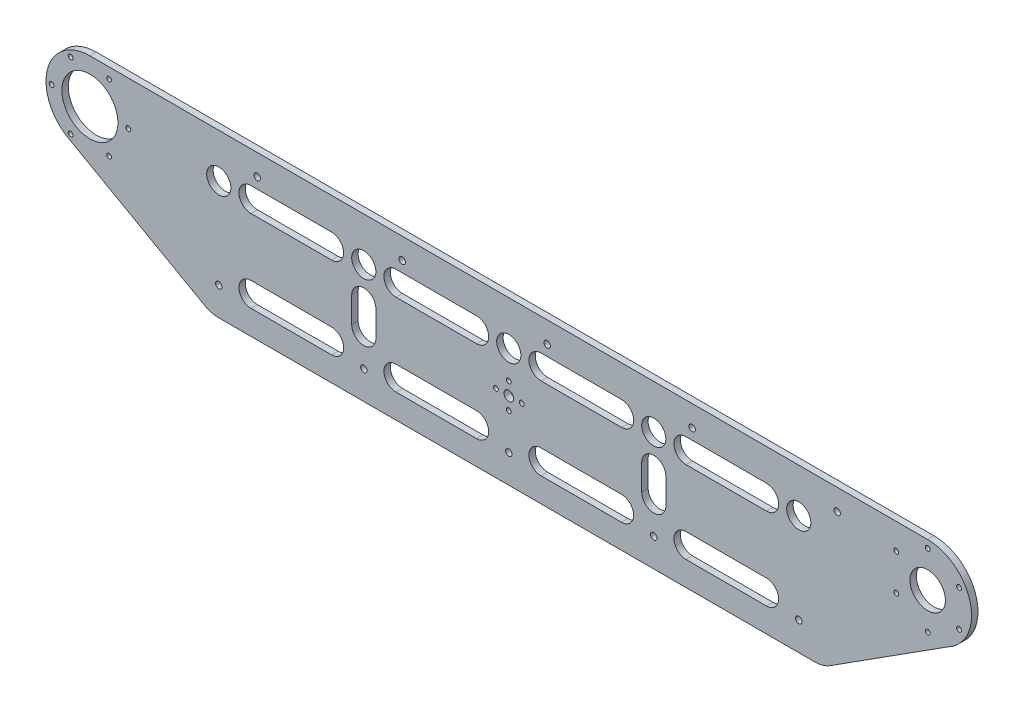
from build123d import *

# Parameters (mm, degrees)
CROQUIS1_R              = 2
CROQUIS1_R_2            = 7.5
CROQUIS1_R_3            = 17.4
CROQUIS1_R_4            = 11
CROQUIS1_R_5            = 1.5
CROQUIS1_R_6            = 3
SALIENTE_EXTRUIR1_DEPTH = 2
CROQUIS2_R              = 1.5
CORTAR_EXTRUIR1_DEPTH   = 10
CROQUIS3_R              = 1.5
CORTAR_EXTRUIR2_DEPTH   = 10
CROQUIS4_R              = 2
CORTAR_EXTRUIR3_DEPTH   = 10


with BuildPart() as part:
    # Croquis1 → Saliente-Extruir1 (new, symmetric)
    with BuildSketch(Plane.XY):
        with BuildLine():
            Line((-179.195612521, -41.480204958), (179.195612521, -41.480204958))
            Line((179.195612521, -41.480204958), (190.010789857, -41.480204958))
            ThreePointArc((190.010789857, -41.480204958), (194.944809403, -40.774865591), (199.483580997, -38.715349889))
            Line((199.483580997, -38.715349889), (272.742664287, 8.031785175))
            ThreePointArc((272.742664287, 8.031785175), (286.437106864, 38.672371901), (260, 59.347542834))
            Line((260, 59.347542834), (-260, 59.347542834))
            ThreePointArc((-260, 59.347542834), (-286.437106864, 38.672371901), (-272.742664287, 8.031785175))
            Line((-272.742664287, 8.031785175), (-188.625622076, -39.240895373))
            ThreePointArc((-188.625622076, -39.240895373), (-184.06774563, -41.022236998), (-179.195612521, -41.480204958))
        make_face()
        with Locations((0, -23.892457166)):
            Circle(CROQUIS1_R, mode=Mode.SUBTRACT)
        with Locations((-90, -23.892457166)):
            Circle(CROQUIS1_R, mode=Mode.SUBTRACT)
        with Locations((-180, -23.892457166)):
            Circle(CROQUIS1_R, mode=Mode.SUBTRACT)
        with Locations((-90, 32.107542834)):
            Circle(CROQUIS1_R_2, mode=Mode.SUBTRACT)
        with Locations((0, 32.107542834)):
            Circle(CROQUIS1_R_2, mode=Mode.SUBTRACT)
        with Locations((-260, 32.107542834)):
            Circle(CROQUIS1_R_3, mode=Mode.SUBTRACT)
        with Locations((260, 32.107542834)):
            Circle(CROQUIS1_R_4, mode=Mode.SUBTRACT)
        with Locations((90, 32.107542834)):
            Circle(CROQUIS1_R_2, mode=Mode.SUBTRACT)
        with Locations((90, -23.892457166)):
            Circle(CROQUIS1_R, mode=Mode.SUBTRACT)
        with Locations((-180, 32.107542834)):
            Circle(CROQUIS1_R_2, mode=Mode.SUBTRACT)
        with Locations((180, 32.107542834)):
            Circle(CROQUIS1_R_2, mode=Mode.SUBTRACT)
        with Locations((-8, 6.607542834)):
            Circle(CROQUIS1_R_5, mode=Mode.SUBTRACT)
        with Locations((0, 14.607542834)):
            Circle(CROQUIS1_R_5, mode=Mode.SUBTRACT)
        with Locations((8, 6.607542834)):
            Circle(CROQUIS1_R_5, mode=Mode.SUBTRACT)
        with Locations((0, -1.392457166)):
            Circle(CROQUIS1_R_5, mode=Mode.SUBTRACT)
        with Locations((0, 6.607542834)):
            Circle(CROQUIS1_R_6, mode=Mode.SUBTRACT)
        with Locations((180, -23.892457166)):
            Circle(CROQUIS1_R, mode=Mode.SUBTRACT)
        with BuildLine():
            Line((-82.5, 12.107542834), (-82.5, -3.892457166))
            ThreePointArc((-82.5, -3.892457166), (-90, -11.392457166), (-97.5, -3.892457166))
            Line((-97.5, -3.892457166), (-97.5, 12.107542834))
            ThreePointArc((-97.5, 12.107542834), (-90, 19.607542834), (-82.5, 12.107542834))
        make_face(mode=Mode.SUBTRACT)
        with BuildLine():
            Line((-20, 24.607542834), (-70, 24.607542834))
            ThreePointArc((-70, 24.607542834), (-77.5, 32.107542834), (-70, 39.607542834))
            Line((-70, 39.607542834), (-20, 39.607542834))
            ThreePointArc((-20, 39.607542834), (-12.5, 32.107542834), (-20, 24.607542834))
        make_face(mode=Mode.SUBTRACT)
        with BuildLine():
            Line((160, -26.392457166), (110, -26.392457166))
            ThreePointArc((110, -26.392457166), (102.5, -18.892457166), (110, -11.392457166))
            Line((110, -11.392457166), (160, -11.392457166))
            ThreePointArc((160, -11.392457166), (167.5, -18.892457166), (160, -26.392457166))
        make_face(mode=Mode.SUBTRACT)
        with BuildLine():
            Line((20, -11.392457166), (70, -11.392457166))
            ThreePointArc((70, -11.392457166), (77.5, -18.892457166), (70, -26.392457166))
            Line((70, -26.392457166), (20, -26.392457166))
            ThreePointArc((20, -26.392457166), (12.5, -18.892457166), (20, -11.392457166))
        make_face(mode=Mode.SUBTRACT)
        with BuildLine():
            Line((20, 39.607542834), (70, 39.607542834))
            ThreePointArc((70, 39.607542834), (77.5, 32.107542834), (70, 24.607542834))
            Line((70, 24.607542834), (20, 24.607542834))
            ThreePointArc((20, 24.607542834), (12.5, 32.107542834), (20, 39.607542834))
        make_face(mode=Mode.SUBTRACT)
        with BuildLine():
            Line((-160, 39.607542834), (-110, 39.607542834))
            ThreePointArc((-110, 39.607542834), (-102.5, 32.107542834), (-110, 24.607542834))
            Line((-110, 24.607542834), (-160, 24.607542834))
            ThreePointArc((-160, 24.607542834), (-167.5, 32.107542834), (-160, 39.607542834))
        make_face(mode=Mode.SUBTRACT)
        with BuildLine():
            Line((-20, -26.392457166), (-70, -26.392457166))
            ThreePointArc((-70, -26.392457166), (-77.5, -18.892457166), (-70, -11.392457166))
            Line((-70, -11.392457166), (-20, -11.392457166))
            ThreePointArc((-20, -11.392457166), (-12.5, -18.892457166), (-20, -26.392457166))
        make_face(mode=Mode.SUBTRACT)
        with BuildLine():
            Line((160, 24.607542834), (110, 24.607542834))
            ThreePointArc((110, 24.607542834), (102.5, 32.107542834), (110, 39.607542834))
            Line((110, 39.607542834), (160, 39.607542834))
            ThreePointArc((160, 39.607542834), (167.5, 32.107542834), (160, 24.607542834))
        make_face(mode=Mode.SUBTRACT)
        with BuildLine():
            Line((-160, -26.392457166), (-110, -26.392457166))
            ThreePointArc((-110, -26.392457166), (-102.5, -18.892457166), (-110, -11.392457166))
            Line((-110, -11.392457166), (-160, -11.392457166))
            ThreePointArc((-160, -11.392457166), (-167.5, -18.892457166), (-160, -26.392457166))
        make_face(mode=Mode.SUBTRACT)
        with BuildLine():
            Line((97.5, 12.107542834), (97.5, -3.892457166))
            ThreePointArc((97.5, -3.892457166), (90, -11.392457166), (82.5, -3.892457166))
            Line((82.5, -3.892457166), (82.5, 12.107542834))
            ThreePointArc((82.5, 12.107542834), (90, 19.607542834), (97.5, 12.107542834))
        make_face(mode=Mode.SUBTRACT)
    extrude(amount=SALIENTE_EXTRUIR1_DEPTH, both=True)

    # Croquis2 → Cortar-Extruir1 (cut)
    with BuildSketch(Plane.XY.offset(2)):
        with Locations((-283.74, 32.107542834)):
            Circle(CROQUIS2_R)
        with Locations((-271.95, 52.805549985)):
            Circle(CROQUIS2_R)
        with Locations((-248.05, 52.805549985)):
            Circle(CROQUIS2_R)
        with Locations((-236.1, 32.107542834)):
            Circle(CROQUIS2_R)
        with Locations((-248.05, 11.409535684)):
            Circle(CROQUIS2_R)
        with Locations((-271.95, 11.409535684)):
            Circle(CROQUIS2_R)
    extrude(amount=-CORTAR_EXTRUIR1_DEPTH, mode=Mode.SUBTRACT)

    # Croquis3 → Cortar-Extruir2 (cut)
    with BuildSketch(Plane.XY.offset(2)):
        with Locations((260, 54.607542834)):
            Circle(CROQUIS3_R)
        with Locations((279.485571585, 43.357542834)):
            Circle(CROQUIS3_R)
        with Locations((279.485571585, 20.857542834)):
            Circle(CROQUIS3_R)
        with Locations((260, 9.607542834)):
            Circle(CROQUIS3_R)
        with Locations((240.514428415, 20.857542834)):
            Circle(CROQUIS3_R)
        with Locations((240.514428415, 43.357542834)):
            Circle(CROQUIS3_R)
    extrude(amount=-CORTAR_EXTRUIR2_DEPTH, mode=Mode.SUBTRACT)

    # Croquis4 → Cortar-Extruir3 (cut)
    with BuildSketch(Plane.XY.offset(2)):
        with Locations((-156.165571585, 46.217542834)):
            Circle(CROQUIS4_R)
        with Locations((-66.165571585, 46.217542834)):
            Circle(CROQUIS4_R)
        with Locations((23.834428415, 46.217542834)):
            Circle(CROQUIS4_R)
        with Locations((113.834428415, 46.217542834)):
            Circle(CROQUIS4_R)
        with Locations((203.834428415, 46.217542834)):
            Circle(CROQUIS4_R)
    extrude(amount=-CORTAR_EXTRUIR3_DEPTH, mode=Mode.SUBTRACT)


solid = part.part
